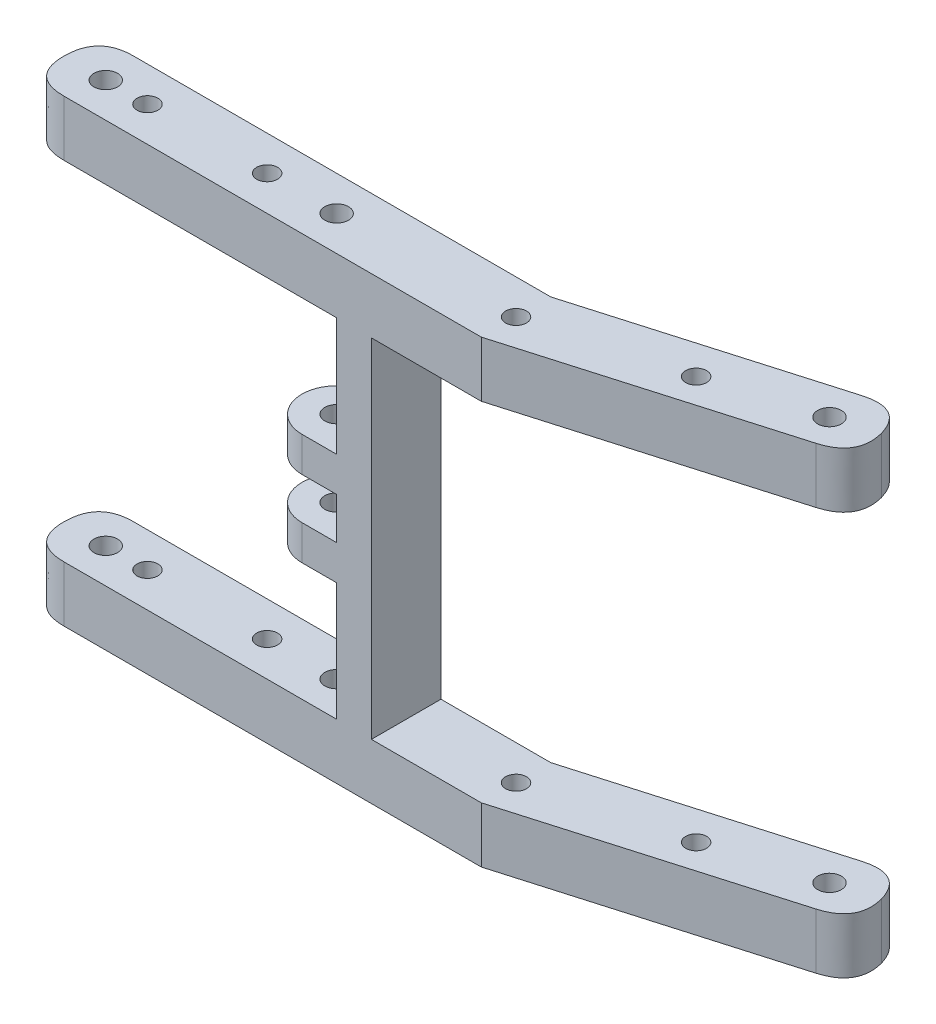
from build123d import *

# Parameters (mm, degrees)
BOSS_EXTRUDE1_DEPTH = 8
SKETCH2_R           = 1.7
SKETCH2_R_2         = 1.5
CUT_EXTRUDE1_DEPTH  = 10
FILLET1_SIZE        = 5
SKETCH3_R           = 5
BOSS_EXTRUDE2_DEPTH = 22
SKETCH4_R           = 1.7
CUT_EXTRUDE2_DEPTH  = 74.393131138
BOSS_EXTRUDE4_DEPTH = 22
SKETCH9_R           = 1.7
CUT_EXTRUDE3_DEPTH  = 17
SKETCH10_W          = 5
SKETCH10_H          = 10
BOSS_EXTRUDE5_DEPTH = 3


with BuildPart() as part:
    # Sketch1 → Boss-Extrude1 (new body)
    with BuildSketch(Plane(origin=(0, 0, 0), x_dir=(1, 0, 0), z_dir=(0, 1, 0))):
        Polygon((0, 5.796570021), (-65, 5.796570021), (-65, -4.203429979), (0, -4.203429979), (42, 8.002969552), (39.5, 17.276398151), align=None)
    extrude(amount=BOSS_EXTRUDE1_DEPTH)

    # Sketch2 → Cut-Extrude1 (cut)
    with BuildSketch(Plane(origin=(0, 8, 0), x_dir=(1, 0, 0), z_dir=(0, 1, 0))):
        with Locations(Location((-59, 0.796570021, 0), (0, 0, 270))):
            Circle(SKETCH2_R)
        with Locations(Location((-53, 0.796570021, 0), (0, 0, 270))):
            Circle(SKETCH2_R_2)
        with Locations(Location((-35.792921067, 0.796570021, 0), (0, 0, 270))):
            Circle(SKETCH2_R_2)
        with Locations(Location((20.375, 6.319841926, 0), (0, 0, 270))):
            Circle(SKETCH2_R_2)
        with Locations(Location((35.015323176, 10.860923065, 0), (0, 0, 270))):
            Circle(SKETCH2_R)
        with Locations(Location((0, 0.796570021, 0), (0, 0, 270))):
            Circle(SKETCH2_R_2)
    extrude(amount=-CUT_EXTRUDE1_DEPTH, mode=Mode.SUBTRACT)

    # Fillet1
    # a fillet whose section is not a circle: 5 mm, written as the material it takes off along each edge
    with BuildSketch(Plane(origin=(-65, -12.5, 4.203429979), x_dir=(0, 0, -1), z_dir=(0, 1, 0)), Plane(origin=(-65, -12.5, -5.796570021), x_dir=(1, 0, 0), z_dir=(0, 1, 0))) as fillet1_piece_1:
        with BuildLine():
            Bezier((FILLET1_SIZE, 0), (0, 0), (0, -FILLET1_SIZE), weights=[1, 1, 1])
            Line((0, -FILLET1_SIZE), (0, 0))
            Line((0, 0), (FILLET1_SIZE, 0))
        make_face()
    extrude(amount=33, mode=Mode.SUBTRACT)

    # Fillet2
    # a fillet whose section is not a circle: 5 mm, written as the material it takes off along each edge
    with BuildSketch(Plane(origin=(39.5, -12.746283343, -17.276398151), x_dir=(-0.9602675163397548, 0, 0.27908116572545455), z_dir=(0, 1, 0))) as fillet2_piece_1:
        with BuildLine():
            Bezier((5.098513337, 0), (0, 0), (0.099464892, 5.097543034), weights=[1, 1, 1])
            Line((0.099464892, 5.097543034), (0, 0))
            Line((0, 0), (5.098513337, 0))
        make_face()
    extrude(amount=33.492566686, mode=Mode.SUBTRACT)
    with BuildSketch(Plane(origin=(42, -12.258475337, -8.002969552), x_dir=(-0.2602945720874772, 0, -0.9655292516241013), z_dir=(0, 1, 0))) as fillet2_piece_2:
        with BuildLine():
            Bezier((4.903390135, 0), (0, 0), (-0.09565831, 4.902456966), weights=[1, 1, 1])
            Line((-0.09565831, 4.902456966), (0, 0))
            Line((0, 0), (4.903390135, 0))
        make_face()
    extrude(amount=32.516950674, mode=Mode.SUBTRACT)

    # Sketch3 → Boss-Extrude2 (add)
    with BuildSketch(Plane(origin=(0, 8, 0), x_dir=(1, 0, 0), z_dir=(0, 1, 0))):
        with Locations(Location((-25.792921067, 0.796570021, 0), (0, 0, 270))):
            Circle(SKETCH3_R)
    extrude(amount=BOSS_EXTRUDE2_DEPTH)

    # Sketch4 → Cut-Extrude2 (cut, through all)
    with BuildSketch(Plane(origin=(0, 30, 0), x_dir=(1, 0, 0), z_dir=(0, 1, 0))):
        with Locations(Location((-25.792921067, 0.796570021, 0), (0, 0, 270))):
            Circle(SKETCH4_R)
    extrude(amount=-CUT_EXTRUDE2_DEPTH, mode=Mode.SUBTRACT)

    # Sketch6 → Boss-Extrude4 (add)
    with BuildSketch(Plane(origin=(0, 8, 0), x_dir=(1, 0, 0), z_dir=(0, 1, 0))):
        with BuildLine():
            Line((-15.792921067, 5.796570021), (-25.792921067, 5.796570021))
            ThreePointArc((-25.792921067, 5.796570021), (-20.792921067, 0.796570021), (-25.792921067, -4.203429979))
            Line((-25.792921067, -4.203429979), (-15.792921067, -4.203429979))
            Line((-15.792921067, -4.203429979), (-15.792921067, 5.796570021))
        make_face()
    extrude(amount=BOSS_EXTRUDE4_DEPTH)

    # Sketch9 → Cut-Extrude3 (cut)
    with BuildSketch(Plane(origin=(0, 25, 0), x_dir=(1, 0, 0), z_dir=(0, 1, 0))):
        with BuildLine():
            Line((-25.792921067, 5.796570021), (-20.792921067, 5.796570021))
            Line((-20.792921067, 5.796570021), (-20.792921067, -4.203429979))
            Line((-20.792921067, -4.203429979), (-25.792921067, -4.203429979))
            ThreePointArc((-25.792921067, -4.203429979), (-30.792921067, 0.796570021), (-25.792921067, 5.796570021))
        make_face()
        with Locations(Location((-25.792921067, 0.796570021, 0), (0, 0, 270))):
            Circle(SKETCH9_R, mode=Mode.SUBTRACT)
    extrude(amount=-CUT_EXTRUDE3_DEPTH, mode=Mode.SUBTRACT)

    # Sketch10 → Boss-Extrude5 (add)
    with BuildSketch(Plane(origin=(0, 30, 0), x_dir=(1, 0, 0), z_dir=(0, 1, 0))):
        with Locations((-18.292921067, 0.796570021)):
            Rectangle(SKETCH10_W, SKETCH10_H)
    extrude(amount=BOSS_EXTRUDE5_DEPTH)

    # Mirror1: part across plane


with BuildPart() as part_1:
    add(part.part)
    add(part.part.mirror(Plane.ZX.offset(33)))


solid = part_1.part
